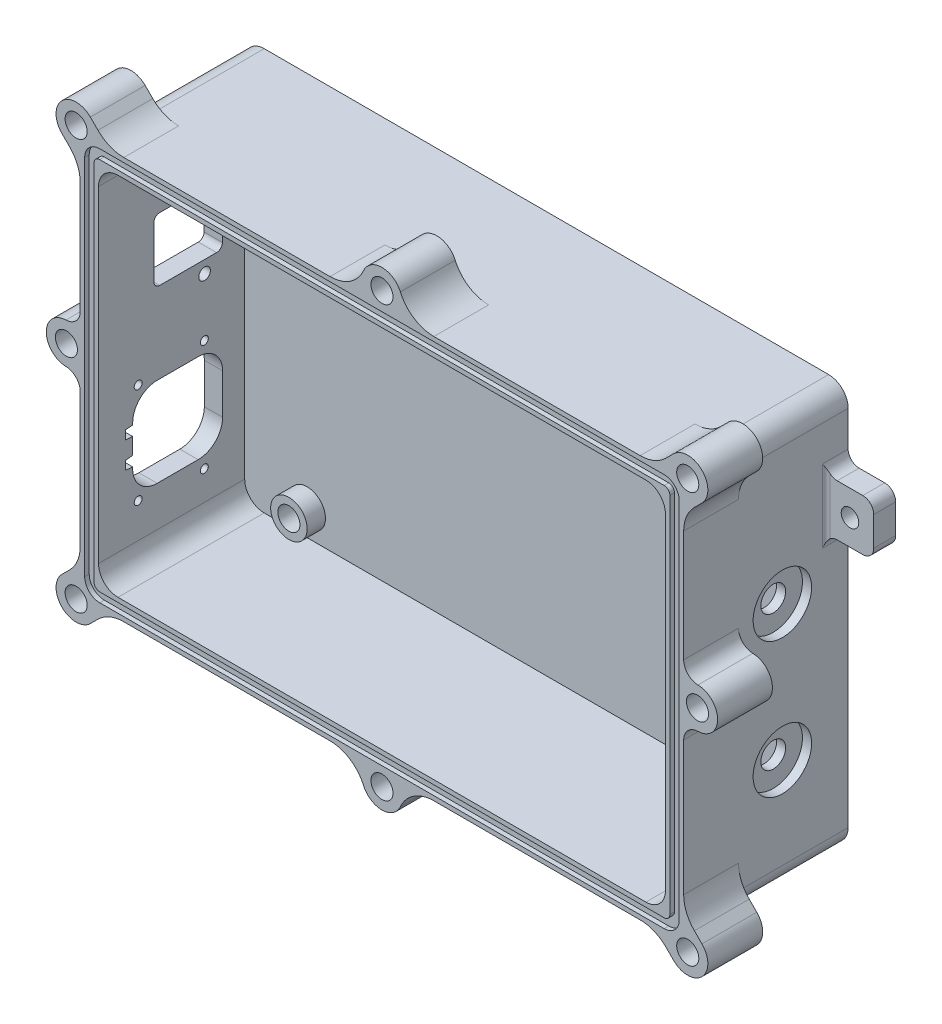
from build123d import *

# Parameters (mm, degrees)
SKETCH1_W                = 165.1
SKETCH1_H                = 110
BOSS_EXTRUDE1_DEPTH      = 45
SHELL1_T                 = -5
FILLET1_R                = 5.334
CUT_EXTRUDE1_DEPTH       = 1.2446
BOSS_EXTRUDE2_DEPTH      = 15
SKETCH4_R                = 3.025
CUT_EXTRUDE2_DEPTH       = 8
MIRROR3_COPY_1_DEPTH     = 15
MIRROR3_COPY_2_SKETCH_R  = 3.025
MIRROR3_COPY_2_DEPTH     = 8
FILLET3_R                = 10
BOSS_EXTRUDE3_DEPTH      = 15
SKETCH6_R                = 3.025
CUT_EXTRUDE3_DEPTH       = 8
FILLET5_R                = 10
BOSS_EXTRUDE4_DEPTH      = 15
SKETCH8_R                = 3.025
CUT_EXTRUDE4_DEPTH       = 8
FILLET6_R                = 4
SKETCH9_R                = 5
SKETCH9_R_2              = 3.025
BOSS_EXTRUDE5_DEPTH      = 5
SKETCH10_W               = 14
SKETCH10_H               = 13
SKETCH10_W_2             = 13
SKETCH10_H_2             = 14
BOSS_EXTRUDE6_DEPTH      = 6
M4_CLEARANCE_HOLE1_D     = 4.8
FILLET7_R                = 3
FILLET8_R                = 1
CUT_EXTRUDE5_DEPTH       = 6
M3_CLEARANCE_HOLE1_D     = 3.2
M3_CLEARANCE_HOLE1_DEPTH = 6
M3_CLEARANCE_HOLE1_TIP   = 0.96137699
CUT_EXTRUDE6_DEPTH       = 6
SKETCH20_R               = 8
SKETCH20_R_2             = 3.4
CUT_EXTRUDE7_DEPTH       = 2.5


with BuildPart() as part:
    # Sketch1 → Boss-Extrude1 (new body)
    with BuildSketch(Plane.XY):
        Rectangle(SKETCH1_W, SKETCH1_H)
    extrude(amount=BOSS_EXTRUDE1_DEPTH)

    # Shell1
    shell1_openings = [part.faces().sort_by_distance(p)[0] for p in [
        (0, 0, 45),
    ]]
    offset(amount=SHELL1_T, openings=shell1_openings, kind=Kind.INTERSECTION)

    # Fillet1
    fillet1_edges = [part.edges().sort_by_distance(p)[0] for p in [
        (77.55, -50, 25),
        (77.55, 50, 25),
        (-77.55, 50, 25),
        (-77.55, -50, 25),
        (82.55, -55, 22.5),
        (-82.55, -55, 22.5),
        (-82.55, 55, 22.5),
        (82.55, 55, 22.5),
    ]]
    fillet(fillet1_edges, radius=FILLET1_R)

    # Sketch2 → Cut-Extrude1 (cut)
    with BuildSketch(Plane.XY.offset(45)):
        with BuildLine():
            Line((-77.216, -53.7827), (77.216, -53.7827))
            ThreePointArc((77.216, -53.7827), (80.126946486, -52.576946486), (81.3327, -49.666))
            Line((81.3327, -49.666), (81.3327, 49.666))
            ThreePointArc((81.3327, 49.666), (80.126946486, 52.576946486), (77.216, 53.7827))
            Line((77.216, 53.7827), (-77.216, 53.7827))
            ThreePointArc((-77.216, 53.7827), (-80.126946486, 52.576946486), (-81.3327, 49.666))
            Line((-81.3327, 49.666), (-81.3327, -49.666))
            ThreePointArc((-81.3327, -49.666), (-80.126946486, -52.576946486), (-77.216, -53.7827))
        make_face()
        with BuildLine():
            Line((-78.7673, 49.666), (-78.7673, -49.666))
            ThreePointArc((-78.7673, -49.666), (-78.31293475, -50.76293475), (-77.216, -51.2173))
            Line((-77.216, -51.2173), (77.216, -51.2173))
            ThreePointArc((77.216, -51.2173), (78.31293475, -50.76293475), (78.7673, -49.666))
            Line((78.7673, -49.666), (78.7673, 49.666))
            ThreePointArc((78.7673, 49.666), (78.31293475, 50.76293475), (77.216, 51.2173))
            Line((77.216, 51.2173), (-77.216, 51.2173))
            ThreePointArc((-77.216, 51.2173), (-78.31293475, 50.76293475), (-78.7673, 49.666))
        make_face(mode=Mode.SUBTRACT)
    extrude(amount=-CUT_EXTRUDE1_DEPTH, mode=Mode.SUBTRACT)

    # Sketch3 → Boss-Extrude2 (add)
    with BuildSketch(Plane.XY.offset(45)):
        with BuildLine():
            ThreePointArc((80.987707571, 53.437707571), (82.143973426, 51.707233428), (82.55, 49.666))
            Line((82.55, 49.666), (82.55, 47.221825407))
            Line((82.55, 47.221825407), (87.551567689, 52.223393096))
            ThreePointArc((87.551567689, 52.223393096), (87.551567689, 60.001567689), (79.773393096, 60.001567689))
            Line((79.773393096, 60.001567689), (74.771825407, 55))
            Line((74.771825407, 55), (77.216, 55))
            ThreePointArc((77.216, 55), (79.257233428, 54.593973426), (80.987707571, 53.437707571))
        make_face()
    boss_extrude2 = extrude(amount=-BOSS_EXTRUDE2_DEPTH)

    # Sketch4 → Cut-Extrude2 (cut)
    with BuildSketch(Plane.XY.offset(45)):
        with Locations((83.662480392, 56.112480392)):
            Circle(SKETCH4_R)
    cut_extrude2 = extrude(amount=-CUT_EXTRUDE2_DEPTH, mode=Mode.SUBTRACT)

    # Mirror2: Boss-Extrude2, Cut-Extrude2 across plane
    add(boss_extrude2.mirror(Plane.ZX))
    add(cut_extrude2.mirror(Plane.ZX), mode=Mode.SUBTRACT)

    # Mirror3: Boss-Extrude2, Cut-Extrude2 across plane
    add(boss_extrude2.mirror(Plane(origin=(0, 0, 0), x_dir=(0, 0, 1), z_dir=(1, 0, 0))))
    add(cut_extrude2.mirror(Plane(origin=(0, 0, 0), x_dir=(0, 0, 1), z_dir=(1, 0, 0))), mode=Mode.SUBTRACT)

    # Mirror3 copy 1 sketch → Mirror3 copy 1 (add)
    with BuildSketch(Plane(origin=(0, 0, 45), x_dir=(-1, 0, 0), z_dir=(0, 0, 1))):
        with BuildLine():
            ThreePointArc((80.987707571, 53.437707571), (82.143973426, 51.707233428), (82.55, 49.666))
            Line((82.55, 49.666), (82.55, 47.221825407))
            Line((82.55, 47.221825407), (87.551567689, 52.223393096))
            ThreePointArc((87.551567689, 52.223393096), (87.551567689, 60.001567689), (79.773393096, 60.001567689))
            Line((79.773393096, 60.001567689), (74.771825407, 55))
            Line((74.771825407, 55), (77.216, 55))
            ThreePointArc((77.216, 55), (79.257233428, 54.593973426), (80.987707571, 53.437707571))
        make_face()
    extrude(amount=-MIRROR3_COPY_1_DEPTH)

    # Mirror3 copy 2 sketch → Mirror3 copy 2 (cut)
    with BuildSketch(Plane(origin=(0, 0, 45), x_dir=(-1, 0, 0), z_dir=(0, 0, 1))):
        with Locations((83.662480392, 56.112480392)):
            Circle(MIRROR3_COPY_2_SKETCH_R)
    extrude(amount=-MIRROR3_COPY_2_DEPTH, mode=Mode.SUBTRACT)

    # Fillet3
    fillet3_edges = [part.edges().sort_by_distance(p)[0] for p in [
        (82.55, 47.221825407, 37.5),
        (74.771825407, 55, 37.5),
        (82.55, -47.221825407, 37.5),
        (74.771825407, -55, 37.5),
        (-82.55, -47.221825407, 37.5),
        (-74.771825407, -55, 37.5),
        (-82.55, 47.221825407, 37.5),
        (-74.771825407, 55, 37.5),
    ]]
    fillet(fillet3_edges, radius=FILLET3_R)

    # Sketch5 → Boss-Extrude3 (add)
    with BuildSketch(Plane.XY.offset(45)):
        with BuildLine():
            Line((0, -55), (-5.5, -55))
            Line((-5.5, -55), (-5.5, -58.7827))
            ThreePointArc((-5.5, -58.7827), (0, -64.2827), (5.5, -58.7827))
            Line((5.5, -58.7827), (5.5, -55))
            Line((5.5, -55), (0, -55))
        make_face()
    boss_extrude3 = extrude(amount=-BOSS_EXTRUDE3_DEPTH)

    # Sketch6 → Cut-Extrude3 (cut)
    with BuildSketch(Plane.XY.offset(45)):
        with Locations((0, -58.7827)):
            Circle(SKETCH6_R)
    cut_extrude3 = extrude(amount=-CUT_EXTRUDE3_DEPTH, mode=Mode.SUBTRACT)

    # Mirror10: Boss-Extrude3, Cut-Extrude3 across plane
    add(boss_extrude3.mirror(Plane.ZX))
    add(cut_extrude3.mirror(Plane.ZX), mode=Mode.SUBTRACT)

    # Fillet5
    # the kernel refuses this fillet: 10 mm, written as the material it adds along each edge
    with BuildSketch(Plane(origin=(5.5, 55, 45), x_dir=(1, 0, 0), z_dir=(0, 0, -1)), Plane(origin=(-5.5, -55, 45), x_dir=(-1, 0, 0), z_dir=(0, 0, -1))) as fillet5_piece_1:
        with BuildLine():
            CenterArc((8.698421768, -10), FILLET5_R, 90, 66.352028346)
            Line((-0.46185034, -5.98883871), (-1.377877551, -5.587722581))
            ThreePointArc((-1.377877551, -5.587722581), (-1, -3.7827), (-1, 0))
            Line((-1, 0), (0, 1))
            Line((0, 1), (8.698421768, 1))
            Line((8.698421768, 1), (8.698421768, 0))
        make_face()
    extrude(amount=15)
    with BuildSketch(Plane(origin=(-5.5, 55, 45), x_dir=(-1, 0, 0), z_dir=(0, 0, -1)), Plane(origin=(5.5, -55, 45), x_dir=(1, 0, 0), z_dir=(0, 0, -1))) as fillet5_piece_2:
        with BuildLine():
            CenterArc((8.698421768, 10), FILLET5_R, 203.647971654, 66.352028346)
            Line((-0.46185034, 5.98883871), (-1.377877551, 5.587722581))
            ThreePointArc((-1.377877551, 5.587722581), (-1, 3.7827), (-1, 0))
            Line((-1, 0), (0, -1))
            Line((0, -1), (8.698421768, -1))
            Line((8.698421768, -1), (8.698421768, 0))
        make_face()
    extrude(amount=15)

    # Sketch7 → Boss-Extrude4 (add)
    with BuildSketch(Plane.XY.offset(45)):
        with BuildLine():
            Line((-82.55, 3.079689783), (-82.55, 8.579689783))
            Line((-82.55, 8.579689783), (-86.3327, 8.579689783))
            ThreePointArc((-86.3327, 8.579689783), (-91.8327, 3.079689783), (-86.3327, -2.420310217))
            Line((-86.3327, -2.420310217), (-82.55, -2.420310217))
            Line((-82.55, -2.420310217), (-82.55, 3.079689783))
        make_face()
    boss_extrude4 = extrude(amount=-BOSS_EXTRUDE4_DEPTH)

    # Sketch8 → Cut-Extrude4 (cut)
    with BuildSketch(Plane.XY.offset(45)):
        with Locations((-86.3327, 3.079689783)):
            Circle(SKETCH8_R)
    cut_extrude4 = extrude(amount=-CUT_EXTRUDE4_DEPTH, mode=Mode.SUBTRACT)

    # Mirror11: Boss-Extrude4, Cut-Extrude4 across plane
    add(boss_extrude4.mirror(Plane(origin=(0, 0, 0), x_dir=(0, 0, 1), z_dir=(1, 0, 0))))
    add(cut_extrude4.mirror(Plane(origin=(0, 0, 0), x_dir=(0, 0, 1), z_dir=(1, 0, 0))), mode=Mode.SUBTRACT)

    # Fillet6
    # the kernel refuses this fillet: 4 mm, written as the material it adds along each edge
    with BuildSketch(Plane(origin=(82.55, 8.579689783, 45), x_dir=(0, 1, 0), z_dir=(0, 0, -1)), Plane(origin=(-82.55, -2.420310217, 45), x_dir=(0, -1, 0), z_dir=(0, 0, -1))) as fillet6_piece_1:
        with BuildLine():
            CenterArc((3.997514449, 4), FILLET6_R, 181.310679877, 88.689320123)
            Line((-0.001439003, 3.908505263), (-0.401334348, 3.899355789))
            ThreePointArc((-0.401334348, 3.899355789), (-0.4, 3.7827), (-0.4, 0))
            Line((-0.4, 0), (0, -0.4))
            Line((0, -0.4), (3.997514449, -0.4))
            Line((3.997514449, -0.4), (3.997514449, 0))
        make_face()
    extrude(amount=15)
    with BuildSketch(Plane(origin=(82.55, -2.420310217, 45), x_dir=(0, -1, 0), z_dir=(0, 0, -1)), Plane(origin=(-82.55, 8.579689783, 45), x_dir=(0, 1, 0), z_dir=(0, 0, -1))) as fillet6_piece_2:
        with BuildLine():
            CenterArc((3.997514449, -4), FILLET6_R, 90, 88.689320123)
            Line((-0.001439003, -3.908505263), (-0.401334348, -3.899355789))
            ThreePointArc((-0.401334348, -3.899355789), (-0.4, -3.7827), (-0.4, 0))
            Line((-0.4, 0), (0, 0.4))
            Line((0, 0.4), (3.997514449, 0.4))
            Line((3.997514449, 0.4), (3.997514449, 0))
        make_face()
    extrude(amount=15)

    # Sketch9 → Boss-Extrude5 (add)
    # profile 1 of 4: a face of its own
    with BuildSketch(Plane.XY.offset(5)):
        with Locations((-60.455, -42.926)):
            Circle(SKETCH9_R)
        with Locations((-60.455, -42.926)):
            Circle(SKETCH9_R_2, mode=Mode.SUBTRACT)
    # profile 2 of 4: a face of its own
    with BuildSketch(Plane.XY.offset(5)):
        with Locations((50.035, -42.926)):
            Circle(SKETCH9_R)
        with Locations((50.035, -42.926)):
            Circle(SKETCH9_R_2, mode=Mode.SUBTRACT)
    # profile 3 of 4: a face of its own
    with BuildSketch(Plane.XY.offset(5)):
        with Locations((50.035, 12.954)):
            Circle(SKETCH9_R)
        with Locations((50.035, 12.954)):
            Circle(SKETCH9_R_2, mode=Mode.SUBTRACT)
    # profile 4 of 4: a face of its own
    with BuildSketch(Plane.XY.offset(5)):
        with Locations((-60.455, 42.799)):
            Circle(SKETCH9_R)
        with Locations((-60.455, 42.799)):
            Circle(SKETCH9_R_2, mode=Mode.SUBTRACT)
    extrude(amount=BOSS_EXTRUDE5_DEPTH)

    # Sketch10 → Boss-Extrude6 (add)
    with BuildSketch(Plane(origin=(0, 0, 0), x_dir=(-1, 0, 0), z_dir=(0, 0, -1))):
        with Locations((57.55, -61.5)):
            Rectangle(SKETCH10_W, SKETCH10_H)
        with Locations((-89.05, 30)):
            Rectangle(SKETCH10_W_2, SKETCH10_H_2)
    extrude(amount=-BOSS_EXTRUDE6_DEPTH)

    # M4 Clearance Hole1 (through all)
    with Locations(Plane.XY.offset(6)):
        with Locations((-57.55, -61.5), (89.05, 30)):
            Hole(M4_CLEARANCE_HOLE1_D / 2)

    # Fillet7
    fillet7_edges = [part.edges().sort_by_distance(p)[0] for p in [
        (-50.55, -68, 3),
        (-50.55, -55, 3),
        (-64.55, -55, 3),
        (-64.55, -68, 3),
        (82.55, 37, 3),
        (82.55, 23, 3),
        (95.55, 23, 3),
        (95.55, 37, 3),
    ]]
    fillet(fillet7_edges, radius=FILLET7_R)

    # Fillet8
    fillet8_edges = [part.edges().sort_by_distance(p)[0] for p in [
        (-57.55, -55, 6),
        (82.55, 30, 6),
    ]]
    fillet(fillet8_edges, radius=FILLET8_R)

    # Sketch14 → Cut-Extrude5 (cut)
    with BuildSketch(Plane.ZY.offset(82.55)):
        with BuildLine():
            Line((35.642548916, -23.722787709), (35.642548916, -19.239118886))
            Line((35.642548916, -19.239118886), (37.642549065, -19.064141514))
            Line((37.642549065, -19.064141514), (37.642549065, -16.697764988))
            Line((37.642549065, -16.697764988), (35.642548916, -16.522787709))
            Line((35.642548916, -16.522787709), (35.642548916, -15.980953302))
            add(Edge.make_bspline(
                [(35.642548916, -15.980953302), (35.642548916, -15.572862351), (35.572061257, -14.773015071), (35.100154956, -13.083606751), (33.820257109, -11.103245109), (31.839895467, -9.823347263), (30.150487147, -9.351440961), (29.350639868, -9.280953302), (28.942548916, -9.280953302)],
                knots=[0, 0, 0, 0, 0.125, 0.25, 0.5, 0.75, 0.875, 1, 1, 1, 1], degree=3))
            Line((28.942548916, -9.280953302), (17.742548916, -9.280953302))
            add(Edge.make_bspline(
                [(17.742548916, -9.280953302), (17.334457964, -9.280953302), (16.534610685, -9.351440961), (14.845202364, -9.823347263), (12.864840723, -11.103245109), (11.584942876, -13.083606751), (11.113036574, -14.773015071), (11.042548916, -15.57286235), (11.042548916, -15.980953302)],
                knots=[0, 0, 0, 0, 0.125, 0.25, 0.5, 0.75, 0.875, 1, 1, 1, 1], degree=3))
            Line((11.042548916, -15.980953302), (11.042548916, -26.980953302))
            add(Edge.make_bspline(
                [(11.042548916, -26.980953302), (11.042548916, -27.389044254), (11.113036574, -28.188891533), (11.584942876, -29.878299854), (12.864840723, -31.858661495), (14.845202364, -33.138559342), (16.534610685, -33.610465644), (17.334457964, -33.680953302), (17.742548916, -33.680953302)],
                knots=[0, 0, 0, 0, 0.125, 0.25, 0.5, 0.75, 0.875, 1, 1, 1, 1], degree=3))
            Line((17.742548916, -33.680953302), (28.942548916, -33.680953302))
            add(Edge.make_bspline(
                [(28.942548916, -33.680953302), (29.350639868, -33.680953302), (30.150487147, -33.610465644), (31.839895467, -33.138559342), (33.820257109, -31.858661495), (35.100154955, -29.878299854), (35.572061257, -28.188891533), (35.642548916, -27.389044254), (35.642548916, -26.980953302)],
                knots=[0, 0, 0, 0, 0.125, 0.25, 0.5, 0.75, 0.875, 1, 1, 1, 1], degree=3))
            Line((35.642548916, -26.980953302), (35.642548916, -26.439118886))
            Line((35.642548916, -26.439118886), (37.642549065, -26.264141514))
            Line((37.642549065, -26.264141514), (37.642549065, -23.897764988))
            Line((37.642549065, -23.897764988), (35.642548916, -23.722787709))
        make_face()
        with BuildLine():
            add(Edge.make_bspline(
                [(29.847820577, 28.510996109), (29.847820577, 28.710852696), (29.77907573, 29.101667446), (29.414395229, 29.677570761), (28.838491914, 30.042251263), (28.447677164, 30.110996109), (28.247820577, 30.110996109)],
                knots=[0, 0, 0, 0, 0.25, 0.5, 0.75, 1, 1, 1, 1], degree=3))
            Line((28.247820577, 30.110996109), (12.697820577, 30.110996109))
            add(Edge.make_bspline(
                [(12.697820577, 30.110996109), (12.49796399, 30.110996109), (12.10714924, 30.042251263), (11.531245925, 29.677570761), (11.166565423, 29.101667446), (11.097820577, 28.710852696), (11.097820577, 28.510996109)],
                knots=[0, 0, 0, 0, 0.25, 0.5, 0.75, 1, 1, 1, 1], degree=3))
            Line((11.097820577, 28.510996109), (11.097820577, 14.460996109))
            add(Edge.make_bspline(
                [(11.097820577, 14.460996109), (11.097820577, 14.261139522), (11.166565423, 13.870324772), (11.531245925, 13.294421457), (12.10714924, 12.929740955), (12.49796399, 12.860996109), (12.697820577, 12.860996109)],
                knots=[0, 0, 0, 0, 0.25, 0.5, 0.75, 1, 1, 1, 1], degree=3))
            Line((12.697820577, 12.860996109), (28.247820577, 12.860996109))
            add(Edge.make_bspline(
                [(28.247820577, 12.860996109), (28.447677164, 12.860996109), (28.838491914, 12.929740955), (29.414395229, 13.294421457), (29.77907573, 13.870324772), (29.847820577, 14.261139522), (29.847820577, 14.460996109)],
                knots=[0, 0, 0, 0, 0.25, 0.5, 0.75, 1, 1, 1, 1], degree=3))
            Line((29.847820577, 14.460996109), (29.847820577, 28.510996109))
        make_face()
        with BuildLine():
            add(Edge.make_bspline(
                [(34.142549735, -34.095953079), (31.972549735, -34.095953079), (31.972549735, -36.265953079), (34.142549735, -36.265953079)],
                knots=[0, 0, 0, 0, 1, 1, 1, 1], degree=3, weights=[1, 0.333333333, 0.333333333, 1]))
            add(Edge.make_bspline(
                [(34.142549735, -36.265953079), (36.312549735, -36.265953079), (36.312549735, -34.095953079), (34.142549735, -34.095953079)],
                knots=[0, 0, 0, 0, 1, 1, 1, 1], degree=3, weights=[1, 0.333333333, 0.333333333, 1]))
        make_face()
        with BuildLine():
            add(Edge.make_bspline(
                [(16.042549735, -35.595953079), (13.872549735, -35.595953079), (13.872549735, -37.765953079), (16.042549735, -37.765953079)],
                knots=[0, 0, 0, 0, 1, 1, 1, 1], degree=3, weights=[1, 0.333333333, 0.333333333, 1]))
            add(Edge.make_bspline(
                [(16.042549735, -37.765953079), (18.212549735, -37.765953079), (18.212549735, -35.595953079), (16.042549735, -35.595953079)],
                knots=[0, 0, 0, 0, 1, 1, 1, 1], degree=3, weights=[1, 0.333333333, 0.333333333, 1]))
        make_face()
        with BuildLine():
            add(Edge.make_bspline(
                [(34.142549735, -6.695953079), (31.972549735, -6.695953079), (31.972549735, -8.865953079), (34.142549735, -8.865953079)],
                knots=[0, 0, 0, 0, 1, 1, 1, 1], degree=3, weights=[1, 0.333333333, 0.333333333, 1]))
            add(Edge.make_bspline(
                [(34.142549735, -8.865953079), (36.312549735, -8.865953079), (36.312549735, -6.695953079), (34.142549735, -6.695953079)],
                knots=[0, 0, 0, 0, 1, 1, 1, 1], degree=3, weights=[1, 0.333333333, 0.333333333, 1]))
        make_face()
        with BuildLine():
            add(Edge.make_bspline(
                [(16.042549735, -5.195953079), (13.872549735, -5.195953079), (13.872549735, -7.365953079), (16.042549735, -7.365953079)],
                knots=[0, 0, 0, 0, 1, 1, 1, 1], degree=3, weights=[1, 0.333333333, 0.333333333, 1]))
            add(Edge.make_bspline(
                [(16.042549735, -7.365953079), (18.212549735, -7.365953079), (18.212549735, -5.195953079), (16.042549735, -5.195953079)],
                knots=[0, 0, 0, 0, 1, 1, 1, 1], degree=3, weights=[1, 0.333333333, 0.333333333, 1]))
        make_face()
    extrude(amount=-CUT_EXTRUDE5_DEPTH, mode=Mode.SUBTRACT)

    # M3 Clearance Hole1
    with Locations(Plane.ZY.offset(82.55)):
        with Locations((15.972820577, 9.485996244), (24.972820577, 33.485996244)):
            Hole(M3_CLEARANCE_HOLE1_D / 2, depth=M3_CLEARANCE_HOLE1_DEPTH)
            with Locations((0, 0, -(M3_CLEARANCE_HOLE1_DEPTH + M3_CLEARANCE_HOLE1_TIP / 2))):  # 118° drill point
                Cone(0, M3_CLEARANCE_HOLE1_D / 2, M3_CLEARANCE_HOLE1_TIP, mode=Mode.SUBTRACT)

    # Sketch19 → Cut-Extrude6 (cut)
    with BuildSketch(Plane(origin=(82.55, 0, 0), x_dir=(0, 0, -1), z_dir=(1, 0, 0))):
        with BuildLine():
            ThreePointArc((-18, -21.266), (-21.4, -24.666), (-18, -28.066))
            Line((-18, -28.066), (-18, -21.266))
        make_face()
        with BuildLine():
            Line((-18, -21.266), (-18, -28.066))
            ThreePointArc((-18, -28.066), (-15.595836944, -27.070163056), (-14.6, -24.666))
            ThreePointArc((-14.6, -24.666), (-15.595836944, -22.261836944), (-18, -21.266))
        make_face()
        with BuildLine():
            ThreePointArc((-18, 15.734), (-21.4, 12.334), (-18, 8.934))
            Line((-18, 8.934), (-18, 15.734))
        make_face()
        with BuildLine():
            Line((-18, 15.734), (-18, 8.934))
            ThreePointArc((-18, 8.934), (-15.595836944, 9.929836944), (-14.6, 12.334))
            ThreePointArc((-14.6, 12.334), (-15.595836944, 14.738163056), (-18, 15.734))
        make_face()
    extrude(amount=-CUT_EXTRUDE6_DEPTH, mode=Mode.SUBTRACT)

    # Sketch20 → Cut-Extrude7 (cut)
    # profile 1 of 2: a face of its own
    with BuildSketch(Plane(origin=(82.55, 0, 0), x_dir=(0, 0, -1), z_dir=(1, 0, 0))):
        with Locations(Location((-18, 12.334, 0), (0, 0, 90))):
            Circle(SKETCH20_R)
        with Locations(Location((-18, 12.334, 0), (0, 0, 90))):
            Circle(SKETCH20_R_2, mode=Mode.SUBTRACT)
    # profile 2 of 2: a face of its own
    with BuildSketch(Plane(origin=(82.55, 0, 0), x_dir=(0, 0, -1), z_dir=(1, 0, 0))):
        with Locations(Location((-18, -24.666, 0), (0, 0, 90))):
            Circle(SKETCH20_R)
        with Locations(Location((-18, -24.666, 0), (0, 0, 90))):
            Circle(SKETCH20_R_2, mode=Mode.SUBTRACT)
    extrude(amount=-CUT_EXTRUDE7_DEPTH, mode=Mode.SUBTRACT)


solid = part.part
